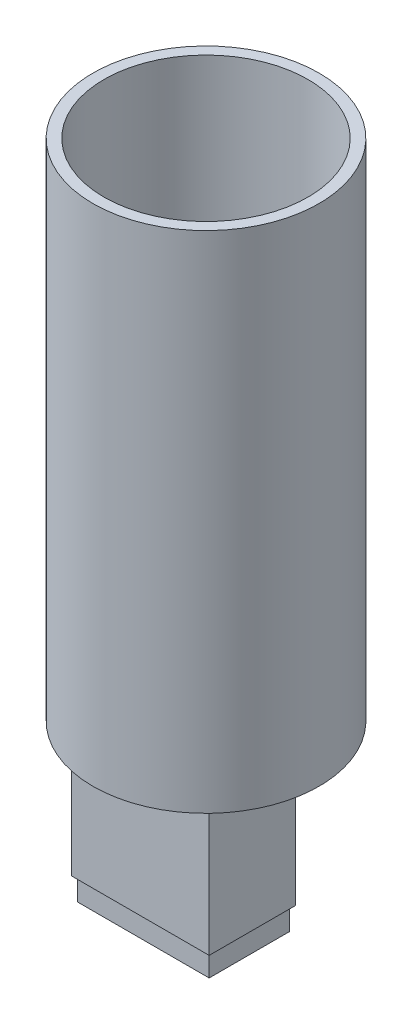
from build123d import *

# Parameters (mm, degrees)
SKETCH1_R               = 15.01
BOSS_EXTRUDE1_DEPTH     = 67
SKETCH2_R               = 13.54
CUT_EXTRUDE1_DEPTH      = 65
SKETCH3_W               = 18.3
SKETCH3_H               = 11.44
BOSS_EXTRUDE2_DEPTH     = 18
CUT_EXTRUDE2_DEPTH      = 16
CUT_EXTRUDE2_DEPTH_BACK = 201
SKETCH4_W               = 15.3
SKETCH4_H               = 8.44
CUT_EXTRUDE3_DEPTH      = 20
BOSS_EXTRUDE3_START     = 3
SKETCH6_W               = 17.5
SKETCH6_H               = 10.64
BOSS_EXTRUDE3_DEPTH     = 3


with BuildPart() as part:
    # Sketch1 → Boss-Extrude1 (new body)
    with BuildSketch(Plane(origin=(0, 0, 0), x_dir=(1, 0, 0), z_dir=(0, 1, 0))):
        Circle(SKETCH1_R)
    extrude(amount=BOSS_EXTRUDE1_DEPTH)

    # Sketch2 → Cut-Extrude1 (cut)
    with BuildSketch(Plane(origin=(0, 67, 0), x_dir=(1, 0, 0), z_dir=(0, 1, 0))):
        Circle(SKETCH2_R)
    extrude(amount=-CUT_EXTRUDE1_DEPTH, mode=Mode.SUBTRACT)

    # Sketch3 → Boss-Extrude2 (add)
    with BuildSketch(Plane.XZ):
        with Locations((0, 3.01)):
            Rectangle(SKETCH3_W, SKETCH3_H)
    extrude(amount=BOSS_EXTRUDE2_DEPTH)

    # Sketch4 → Cut-Extrude2 (cut, two sides: drawn at the far end of the back side and taken through both)
    with BuildSketch(Plane(origin=(0, 0, 0), x_dir=(-1, 0, 0), z_dir=(0, -1, 0)).offset(-CUT_EXTRUDE2_DEPTH_BACK)):
        with Locations((0, -3.01)):
            Rectangle(SKETCH4_W, SKETCH4_H)
    extrude(amount=CUT_EXTRUDE2_DEPTH + CUT_EXTRUDE2_DEPTH_BACK, mode=Mode.SUBTRACT)

    # Sketch5 → Cut-Extrude3 (cut)
    with BuildSketch(Plane.XZ.offset(18)):
        with BuildLine():
            Line((-3.5, 7.01), (3.5, 7.01))
            ThreePointArc((3.5, 7.01), (7.5, 3.01), (3.5, -0.99))
            Line((3.5, -0.99), (-3.5, -0.99))
            ThreePointArc((-3.5, -0.99), (-7.5, 3.01), (-3.5, 7.01))
        make_face()
    extrude(amount=-CUT_EXTRUDE3_DEPTH, mode=Mode.SUBTRACT)

    # Sketch6 → Boss-Extrude3 (add)
    with BuildSketch(Plane.XZ.offset(18).offset(BOSS_EXTRUDE3_START)):
        with Locations((0, 3.01)):
            Rectangle(SKETCH6_W, SKETCH6_H)
        with BuildLine():
            Line((-3.5, 7.01), (3.5, 7.01))
            ThreePointArc((3.5, 7.01), (7.5, 3.01), (3.5, -0.99))
            Line((3.5, -0.99), (-3.5, -0.99))
            ThreePointArc((-3.5, -0.99), (-7.5, 3.01), (-3.5, 7.01))
        make_face(mode=Mode.SUBTRACT)
    extrude(amount=-BOSS_EXTRUDE3_DEPTH)


solid = part.part
